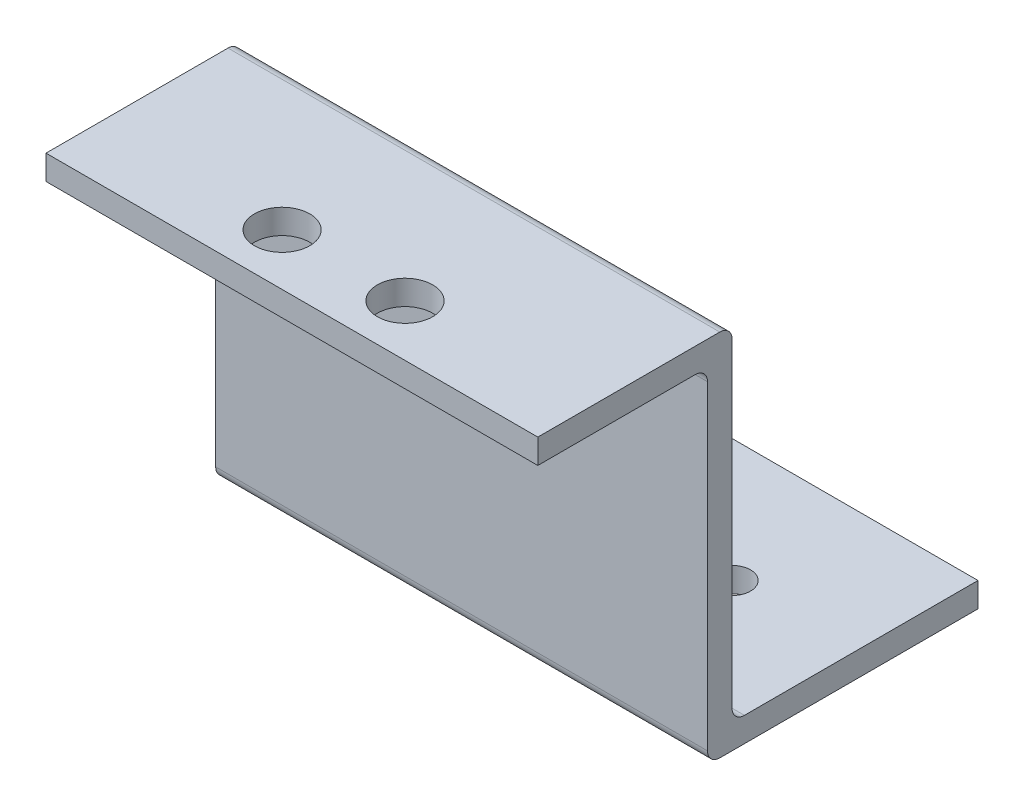
from build123d import *

# Parameters (mm, degrees)
SKETCH1_W           = 40
SKETCH1_H           = 100
SKETCH1_R           = 1.5
SKETCH1_R_2         = 2.25
BOSS_EXTRUDE1_DEPTH = 2
SKETCH2_W           = 40
SKETCH2_H           = 16
CUT_EXTRUDE1_DEPTH  = 10
SKETCH4_W           = 40
SKETCH4_H           = 2
BOSS_EXTRUDE2_DEPTH = 30
SKETCH5_W           = 40
SKETCH5_H           = 2
BOSS_EXTRUDE3_DEPTH = 20
SKETCH6_W           = 40
SKETCH6_H           = 2
BOSS_EXTRUDE4_DEPTH = 20
FILLET1_R           = 1
SKETCH7_R           = 1.5
CUT_EXTRUDE2_DEPTH  = 20
SKETCH8_R           = 1.5
CUT_EXTRUDE3_DEPTH  = 20
SKETCH9_R           = 2.25
CUT_EXTRUDE4_DEPTH  = 68.136662164
SKETCH10_W          = 1
SKETCH10_H          = 6.8
BOSS_EXTRUDE5_DEPTH = 2


with BuildPart() as part:
    # Sketch1 → Boss-Extrude1 (new body)
    with BuildSketch(Plane(origin=(0, 0, 0), x_dir=(1, 0, 0), z_dir=(0, 1, 0))):
        with Locations((0.735982487, -0.367991244)):
            Rectangle(SKETCH1_W, SKETCH1_H)
        with Locations((-9.264017513, -40.367991244)):
            Circle(SKETCH1_R, mode=Mode.SUBTRACT)
        with Locations((-4.264017513, -24.767991244)):
            Circle(SKETCH1_R_2, mode=Mode.SUBTRACT)
        with Locations((10.735982487, -40.367991244)):
            Circle(SKETCH1_R, mode=Mode.SUBTRACT)
        with Locations((5.735982487, -24.767991244)):
            Circle(SKETCH1_R_2, mode=Mode.SUBTRACT)
        with Locations((-4.264017513, 24.032008756)):
            Circle(SKETCH1_R_2, mode=Mode.SUBTRACT)
        with Locations((-9.264017513, 39.632008756)):
            Circle(SKETCH1_R, mode=Mode.SUBTRACT)
        Polygon((0.235982487, 26.632008756), (0.735982487, 26.632008756), (1.235982487, 26.632008756), (1.235982487, 19.832008756), (10.735982487, 19.832008756), (10.735982487, -20.567991244), (1.235982487, -20.567991244), (1.235982487, -27.367991244), (0.735982487, -27.367991244), (0.235982487, -27.367991244), (0.235982487, -20.567991244), (-9.264017513, -20.567991244), (-9.264017513, 19.832008756), (0.235982487, 19.832008756), align=None, mode=Mode.SUBTRACT)
        with Locations((5.735982487, 24.032008756)):
            Circle(SKETCH1_R_2, mode=Mode.SUBTRACT)
        with Locations((10.735982487, 39.632008756)):
            Circle(SKETCH1_R, mode=Mode.SUBTRACT)
    extrude(amount=BOSS_EXTRUDE1_DEPTH)

    # Sketch2 → Cut-Extrude1 (cut)
    with BuildSketch(Plane(origin=(0, 2, 0), x_dir=(1, 0, 0), z_dir=(0, 1, 0))):
        with Locations((0.735982487, 41.632008756)):
            Rectangle(SKETCH2_W, SKETCH2_H)
        with Locations((0.735982487, -42.367991244)):
            Rectangle(SKETCH2_W, SKETCH2_H)
    extrude(amount=-CUT_EXTRUDE1_DEPTH, mode=Mode.SUBTRACT)

    # Sketch4 → Boss-Extrude2 (add)
    with BuildSketch(Plane(origin=(0, 2, 0), x_dir=(1, 0, 0), z_dir=(0, 1, 0))):
        with Locations((0.735982487, -35.367991244)):
            Rectangle(SKETCH4_W, SKETCH4_H)
        with Locations((0.735982487, 34.632008756)):
            Rectangle(SKETCH4_W, SKETCH4_H)
    extrude(amount=-BOSS_EXTRUDE2_DEPTH)

    # Sketch5 → Boss-Extrude3 (add)
    with BuildSketch(Plane(origin=(0, 0, -35.632008756), x_dir=(-1, 0, 0), z_dir=(0, 0, -1))):
        with Locations((-0.735982487, -27)):
            Rectangle(SKETCH5_W, SKETCH5_H)
    extrude(amount=BOSS_EXTRUDE3_DEPTH)

    # Sketch6 → Boss-Extrude4 (add)
    with BuildSketch(Plane.XY.offset(36.367991244)):
        with Locations((0.735982487, -27)):
            Rectangle(SKETCH6_W, SKETCH6_H)
    extrude(amount=BOSS_EXTRUDE4_DEPTH)

    # Fillet1
    fillet1_edges = [part.edges().sort_by_distance(p)[0] for p in [
        (0.735982487, -28, -33.632008756),
        (0.735982487, -26, -35.632008756),
        (0.735982487, 2, -35.632008756),
        (0.735982487, 0, -33.632008756),
        (0.735982487, 0, 34.367991244),
        (0.735982487, 2, 36.367991244),
        (0.735982487, -28, 34.367991244),
        (0.735982487, -26, 36.367991244),
    ]]
    fillet(fillet1_edges, radius=FILLET1_R)

    # Sketch7 → Cut-Extrude2 (cut)
    with BuildSketch(Plane(origin=(0, -26, 0), x_dir=(1, 0, 0), z_dir=(0, 1, 0))):
        with Locations((-9.264017513, 45.632008756)):
            Circle(SKETCH7_R)
        with Locations((10.735982487, 45.632008756)):
            Circle(SKETCH7_R)
    extrude(amount=-CUT_EXTRUDE2_DEPTH, mode=Mode.SUBTRACT)

    # Sketch8 → Cut-Extrude3 (cut)
    with BuildSketch(Plane(origin=(0, -26, 0), x_dir=(1, 0, 0), z_dir=(0, 1, 0))):
        with Locations((10.735982487, -46.367991244)):
            Circle(SKETCH8_R)
        with Locations((-9.264017513, -46.367991244)):
            Circle(SKETCH8_R)
    extrude(amount=-CUT_EXTRUDE3_DEPTH, mode=Mode.SUBTRACT)

    # Sketch9 → Cut-Extrude4 (cut, through all)
    with BuildSketch(Plane(origin=(0, 2, 0), x_dir=(1, 0, 0), z_dir=(0, 1, 0))):
        Polygon((-32.318048619, 19.832008756), (-32.318048619, -99.31179038), (10.735982487, -99.31179038), (10.735982487, -106.86631097), (36.675013235, -106.86631097), (36.675013235, 19.832008756), align=None)
        with Locations((5.735982487, -24.767991244)):
            Circle(SKETCH9_R, mode=Mode.SUBTRACT)
        with Locations((-4.264017513, -24.767991244)):
            Circle(SKETCH9_R, mode=Mode.SUBTRACT)
    extrude(amount=-CUT_EXTRUDE4_DEPTH, mode=Mode.SUBTRACT)

    # Sketch10 → Boss-Extrude5 (add)
    with BuildSketch(Plane(origin=(0, 2, 0), x_dir=(1, 0, 0), z_dir=(0, 1, 0))):
        with Locations((0.735982487, 23.232008756)):
            Rectangle(SKETCH10_W, SKETCH10_H)
    extrude(amount=-BOSS_EXTRUDE5_DEPTH)


solid = part.part
